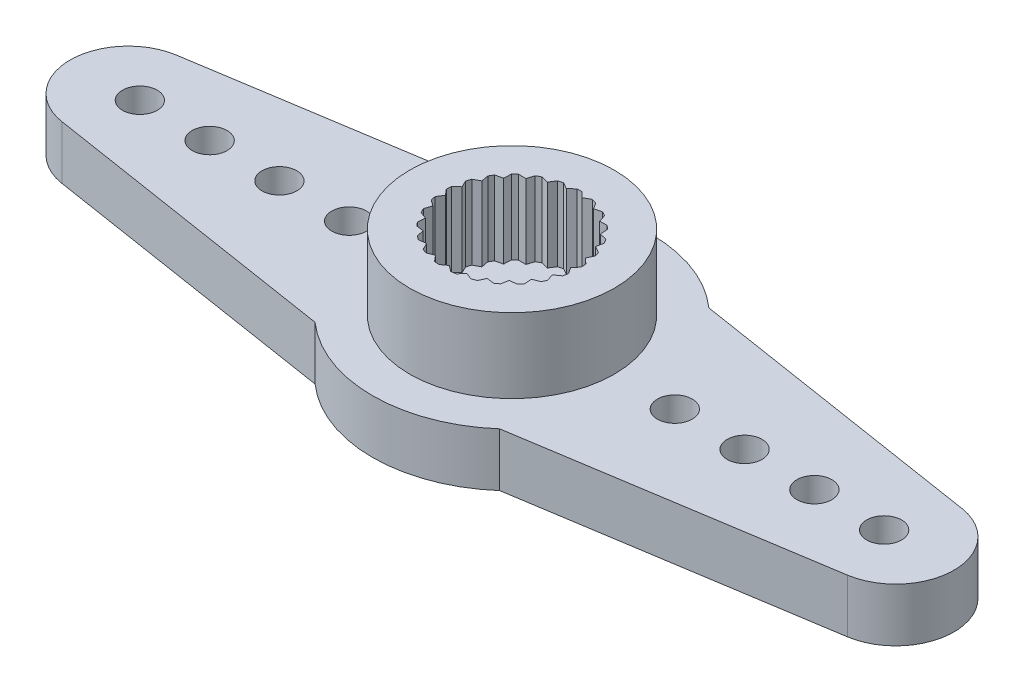
from build123d import *

# Parameters (mm, degrees)
SKETCH2_R           = 6
SKETCH2_R_2         = 1.5
BOSS_EXTRUDE1_DEPTH = 1.15
SKETCH3_R           = 4.4
BOSS_EXTRUDE2_DEPTH = 3.2
SKETCH4_R           = 0.75
BOSS_EXTRUDE3_DEPTH = 1.15
CIRPATTERN1_COUNT   = 2


with BuildPart() as part:
    # Sketch2 → Boss-Extrude1 (new, symmetric)
    with BuildSketch(Plane(origin=(0, 0, 0), x_dir=(1, 0, 0), z_dir=(0, 1, 0))):
        Circle(SKETCH2_R)
        Circle(SKETCH2_R_2, mode=Mode.SUBTRACT)
    extrude(amount=BOSS_EXTRUDE1_DEPTH, both=True)

    # Sketch3 → Boss-Extrude2 (add)
    with BuildSketch(Plane(origin=(0, 1.15, 0), x_dir=(1, 0, 0), z_dir=(0, 1, 0))):
        Circle(SKETCH3_R)
        with BuildLine():
            Line((0.107421435, 2.898009771), (0.338399731, 2.678709694))
            Line((0.338399731, 2.678709694), (0.61665913, 2.83367809))
            ThreePointArc((0.61665913, 2.83367809), (0.721200673, 2.808891167), (0.824752316, 2.780248841))
            Line((0.824752316, 2.780248841), (0.993936292, 2.510396512))
            Line((0.993936292, 2.510396512), (1.301992734, 2.591295993))
            ThreePointArc((1.301992734, 2.591295993), (1.397085655, 2.541289372), (1.490260976, 2.48779465))
            Line((1.490260976, 2.48779465), (1.587020181, 2.184345885))
            Line((1.587020181, 2.184345885), (1.905517346, 2.186093238))
            ThreePointArc((1.905517346, 2.186093238), (1.985186607, 2.11400902), (2.062131058, 2.039023173))
            Line((2.062131058, 2.039023173), (2.080385755, 1.721044772))
            Line((2.080385755, 1.721044772), (2.389311295, 1.643530205))
            ThreePointArc((2.389311295, 1.643530205), (2.448550984, 1.553897705), (2.504429862, 1.46213237))
            Line((2.504429862, 1.46213237), (2.443033042, 1.149604087))
            Line((2.443033042, 1.149604087), (2.722976028, 0.997698125))
            ThreePointArc((2.722976028, 0.997698125), (2.758063897, 0.896149284), (2.789366126, 0.793370413))
            Line((2.789366126, 0.793370413), (2.652175577, 0.505929549))
            Line((2.652175577, 0.505929549), (2.885546163, 0.289177003))
            ThreePointArc((2.885546163, 0.289177003), (2.894277512, 0.182092507), (2.899036259, 0.074758075))
            Line((2.899036259, 0.074758075), (2.694672167, -0.169534403))
            Line((2.694672167, -0.169534403), (2.866806821, -0.437514174))
            ThreePointArc((2.866806821, -0.437514174), (2.848633027, -0.543405812), (2.826549281, -0.648551587))
            Line((2.826549281, -0.648551587), (2.567852594, -0.834345885))
            Line((2.567852594, -0.834345885), (2.667935462, -1.136714727))
            ThreePointArc((2.667935462, -1.136714727), (2.623998452, -1.234759946), (2.576459817, -1.331110368))
            Line((2.576459817, -1.331110368), (2.279685399, -1.446732346))
            Line((2.279685399, -1.446732346), (2.301427906, -1.764491312))
            ThreePointArc((2.301427906, -1.764491312), (2.234488404, -1.84852957), (2.164481907, -1.930030589))
            Line((2.164481907, -1.930030589), (1.848277186, -1.968215294))
            Line((1.848277186, -1.968215294), (1.790313171, -2.281398419))
            ThreePointArc((1.790313171, -2.281398419), (1.704577232, -2.346149284), (1.616501638, -2.40767989))
            Line((1.616501638, -2.40767989), (1.30073492, -2.366028036))
            Line((1.30073492, -2.366028036), (1.166706475, -2.654956874))
            ThreePointArc((1.166706475, -2.654956874), (1.067561203, -2.696351809), (0.966950626, -2.734045809))
            Line((0.966950626, -2.734045809), (0.671462695, -2.615174535))
            Line((0.671462695, -2.615174535), (0.469791321, -2.861694623))
            ThreePointArc((0.469791321, -2.861694623), (0.363466377, -2.877132634), (0.25664255, -2.888621575))
            Line((0.25664255, -2.888621575), (0, -2.7))
            Line((0, -2.7), (-0.25664255, -2.888621575))
            ThreePointArc((-0.25664255, -2.888621575), (-0.363466377, -2.877132634), (-0.469791321, -2.861694623))
            Line((-0.469791321, -2.861694623), (-0.671462695, -2.615174535))
            Line((-0.671462695, -2.615174535), (-0.966950626, -2.734045809))
            ThreePointArc((-0.966950626, -2.734045809), (-1.067561203, -2.696351809), (-1.166706475, -2.654956874))
            Line((-1.166706475, -2.654956874), (-1.30073492, -2.366028036))
            Line((-1.30073492, -2.366028036), (-1.616501638, -2.40767989))
            ThreePointArc((-1.616501638, -2.40767989), (-1.704577232, -2.346149284), (-1.790313171, -2.281398419))
            Line((-1.790313171, -2.281398419), (-1.848277186, -1.968215294))
            Line((-1.848277186, -1.968215294), (-2.164481907, -1.930030589))
            ThreePointArc((-2.164481907, -1.930030589), (-2.234488404, -1.84852957), (-2.301427906, -1.764491312))
            Line((-2.301427906, -1.764491312), (-2.279685399, -1.446732346))
            Line((-2.279685399, -1.446732346), (-2.576459817, -1.331110368))
            ThreePointArc((-2.576459817, -1.331110368), (-2.623998452, -1.234759946), (-2.667935462, -1.136714727))
            Line((-2.667935462, -1.136714727), (-2.567852594, -0.834345885))
            Line((-2.567852594, -0.834345885), (-2.826549281, -0.648551587))
            ThreePointArc((-2.826549281, -0.648551587), (-2.848633027, -0.543405812), (-2.866806821, -0.437514174))
            Line((-2.866806821, -0.437514174), (-2.694672167, -0.169534403))
            Line((-2.694672167, -0.169534403), (-2.899036259, 0.074758075))
            ThreePointArc((-2.899036259, 0.074758075), (-2.894277512, 0.182092507), (-2.885546163, 0.289177003))
            Line((-2.885546163, 0.289177003), (-2.652175577, 0.505929549))
            Line((-2.652175577, 0.505929549), (-2.789366126, 0.793370413))
            ThreePointArc((-2.789366126, 0.793370413), (-2.758063897, 0.896149284), (-2.722976028, 0.997698125))
            Line((-2.722976028, 0.997698125), (-2.443033042, 1.149604087))
            Line((-2.443033042, 1.149604087), (-2.504429862, 1.46213237))
            ThreePointArc((-2.504429862, 1.46213237), (-2.448550984, 1.553897705), (-2.389311295, 1.643530205))
            Line((-2.389311295, 1.643530205), (-2.080385755, 1.721044772))
            Line((-2.080385755, 1.721044772), (-2.062131058, 2.039023173))
            ThreePointArc((-2.062131058, 2.039023173), (-1.985186607, 2.11400902), (-1.905517346, 2.186093238))
            Line((-1.905517346, 2.186093238), (-1.587020181, 2.184345885))
            Line((-1.587020181, 2.184345885), (-1.490260976, 2.48779465))
            ThreePointArc((-1.490260976, 2.48779465), (-1.397085655, 2.541289372), (-1.301992734, 2.591295993))
            Line((-1.301992734, 2.591295993), (-0.993936292, 2.510396512))
            Line((-0.993936292, 2.510396512), (-0.824752316, 2.780248841))
            ThreePointArc((-0.824752316, 2.780248841), (-0.721200673, 2.808891167), (-0.61665913, 2.83367809))
            Line((-0.61665913, 2.83367809), (-0.338399731, 2.678709694))
            Line((-0.338399731, 2.678709694), (-0.107421435, 2.898009771))
            ThreePointArc((-0.107421435, 2.898009771), (0, 2.9), (0.107421435, 2.898009771))
        make_face(mode=Mode.SUBTRACT)
    extrude(amount=BOSS_EXTRUDE2_DEPTH)

    # Sketch4 → Boss-Extrude3 (add, symmetric)
    with BuildSketch(Plane(origin=(0, 0, 0), x_dir=(1, 0, 0), z_dir=(0, 1, 0))):
        with BuildLine():
            Line((3.968626967, 4.5), (16.888114198, 2.469689731))
            ThreePointArc((16.888114198, 2.469689731), (19, 0), (16.888114198, -2.469689731))
            Line((16.888114198, -2.469689731), (3.968626967, -4.5))
            ThreePointArc((3.968626967, -4.5), (6, 0), (3.968626967, 4.5))
        make_face()
        with Locations((16, 0)):
            Circle(SKETCH4_R, mode=Mode.SUBTRACT)
        with Locations((13, 0)):
            Circle(SKETCH4_R, mode=Mode.SUBTRACT)
        with Locations((10, 0)):
            Circle(SKETCH4_R, mode=Mode.SUBTRACT)
        with Locations((7, 0)):
            Circle(SKETCH4_R, mode=Mode.SUBTRACT)
    boss_extrude3 = extrude(amount=BOSS_EXTRUDE3_DEPTH, both=True)

    # CirPattern1: Boss-Extrude3 ×2 about axis
    cirpattern1_axis = Axis((0, 4.35, 0), (0, 1, 0))
    for i in range(1, CIRPATTERN1_COUNT):
        add(boss_extrude3.rotate(cirpattern1_axis, i * 360 / CIRPATTERN1_COUNT))


solid = part.part
